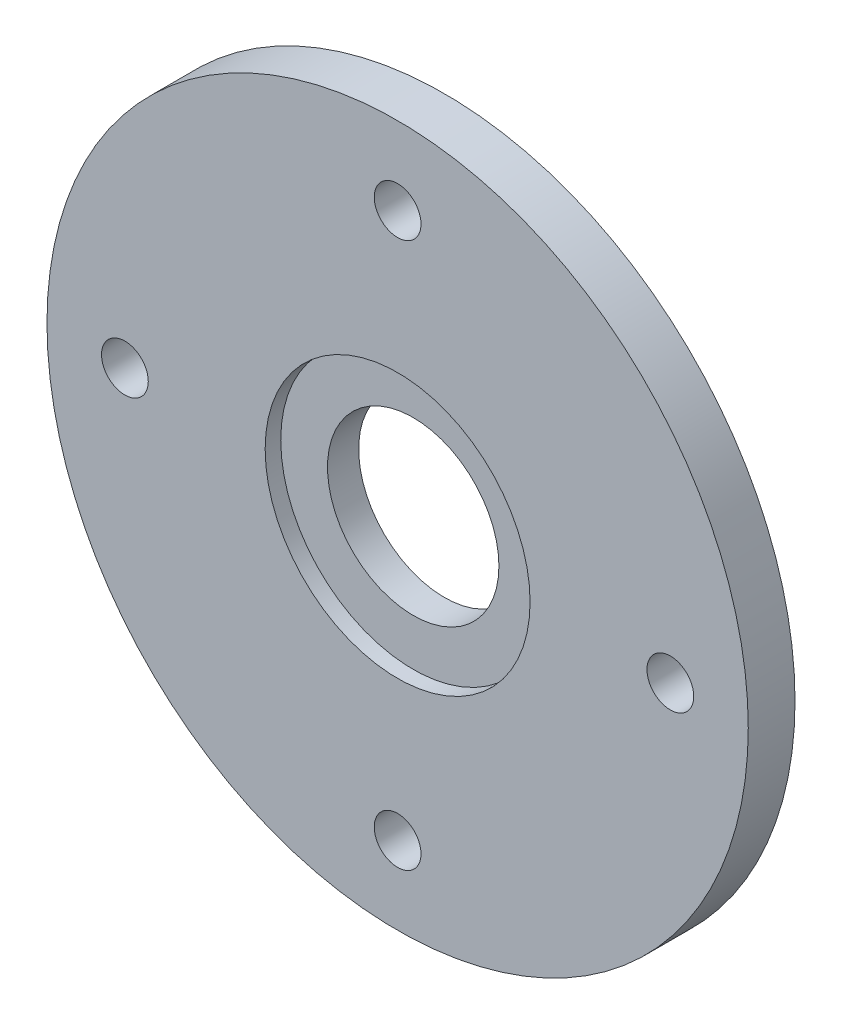
from build123d import *

# Parameters (mm, degrees)
SKETCH_1_R               = 22.5
SKETCH_1_R_2             = 5.5
EXTRUDE_1_DEPTH          = 3
SKETCH_2_R               = 1.5
CUT_EXTRUDE_1_DEPTH      = 32.960913629
PATTERN_CIRCULAR_2_COUNT = 4
CUT_EXTRUDE_START        = -1
SKETCH_3_R               = 8.5
SKETCH_3_R_2             = 5.5
CUT_EXTRUDE_2_DEPTH      = 1


with BuildPart() as part:
    # ｽｹｯﾁ1 → ﾎﾞｽ - 押し出し1 (new body)
    with BuildSketch(Plane.XY):
        Circle(SKETCH_1_R)
        Circle(SKETCH_1_R_2, mode=Mode.SUBTRACT)
    extrude(amount=EXTRUDE_1_DEPTH)

    # ｽｹｯﾁ2 → ｶｯﾄ - 押し出し1 (cut, through all)
    with BuildSketch(Plane.XY.offset(3)):
        with Locations((-17.5, 0)):
            Circle(SKETCH_2_R)
    cut_extrude_1 = extrude(amount=-CUT_EXTRUDE_1_DEPTH, mode=Mode.SUBTRACT)

    # 円形ﾊﾟﾀｰﾝ2: ｶｯﾄ - 押し出し1 ×4 about axis
    pattern_circular_2_axis = Axis((0, 0, 3), (0, 0, -1))
    for i in range(1, PATTERN_CIRCULAR_2_COUNT):
        add(cut_extrude_1.rotate(pattern_circular_2_axis, i * 360 / PATTERN_CIRCULAR_2_COUNT), mode=Mode.SUBTRACT)

    # ｽｹｯﾁ3 → ｶｯﾄ - 押し出し2 (cut)
    with BuildSketch(Plane.XY.offset(3).offset(CUT_EXTRUDE_START)):
        Circle(SKETCH_3_R)
        Circle(SKETCH_3_R_2, mode=Mode.SUBTRACT)
    extrude(amount=CUT_EXTRUDE_2_DEPTH, mode=Mode.SUBTRACT)


solid = part.part
